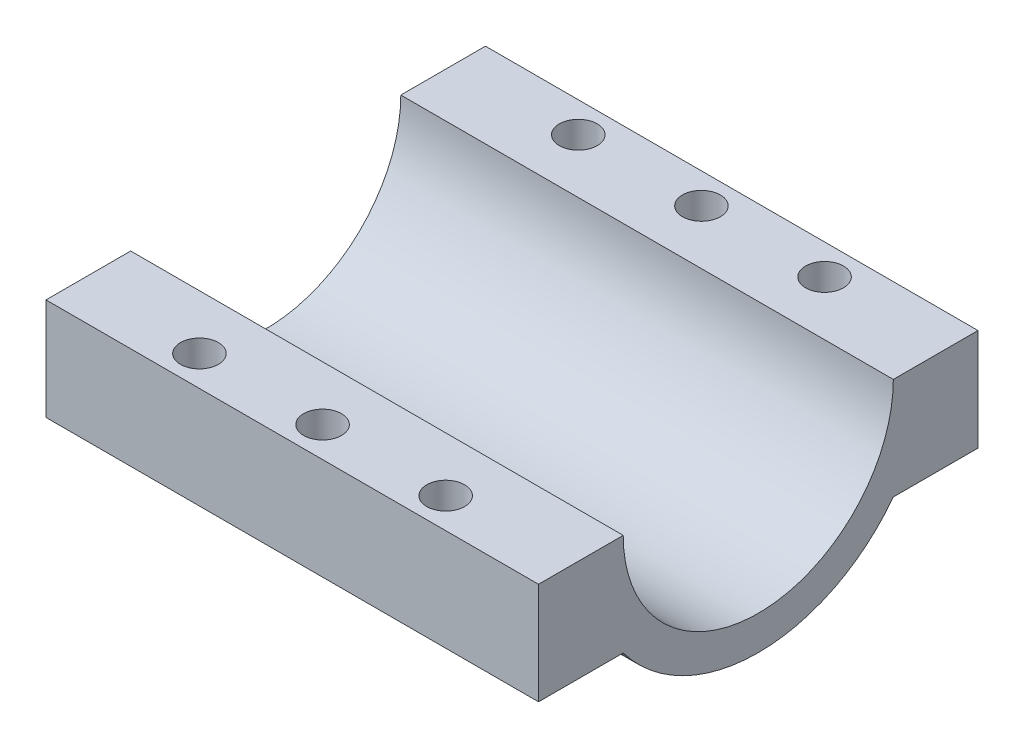
from build123d import *

# Parameters (mm, degrees)
SKETCH1_W           = 65
SKETCH1_H           = 58
SKETCH1_R           = 2.5
BOSS_EXTRUDE1_DEPTH = 22.325
SKETCH2_R           = 17.825
CUT_EXTRUDE1_DEPTH  = 75.594943696


with BuildPart() as part:
    # Sketch1 → Boss-Extrude1 (new body)
    with BuildSketch(Plane(origin=(0, 0, 0), x_dir=(1, 0, 0), z_dir=(0, 1, 0))):
        Rectangle(SKETCH1_W, SKETCH1_H)
        with Locations((-16.25, 25)):
            Circle(SKETCH1_R, mode=Mode.SUBTRACT)
        with Locations((16.25, 25)):
            Circle(SKETCH1_R, mode=Mode.SUBTRACT)
        with Locations((16.25, -25)):
            Circle(SKETCH1_R, mode=Mode.SUBTRACT)
        with Locations((-16.25, -25)):
            Circle(SKETCH1_R, mode=Mode.SUBTRACT)
        with Locations((0, 25)):
            Circle(SKETCH1_R, mode=Mode.SUBTRACT)
        with Locations((0, -25)):
            Circle(SKETCH1_R, mode=Mode.SUBTRACT)
    extrude(amount=BOSS_EXTRUDE1_DEPTH)

    # Sketch2 → Cut-Extrude1 (cut, through all)
    with BuildSketch(Plane(origin=(32.5, 0, 0), x_dir=(0, 0, -1), z_dir=(1, 0, 0))):
        with Locations((0, 22.325)):
            Circle(SKETCH2_R)
        with BuildLine():
            Line((-17.825, 8.88345991), (-29, 8.88345991))
            Line((-29, 8.88345991), (-29, -2.88343075))
            Line((-29, -2.88343075), (29, -2.88343075))
            Line((29, -2.88343075), (29, 8.88345991))
            Line((29, 8.88345991), (17.825, 8.88345991))
            ThreePointArc((17.825, 8.88345991), (0, 0), (-17.825, 8.88345991))
        make_face()
    extrude(amount=-CUT_EXTRUDE1_DEPTH, mode=Mode.SUBTRACT)


solid = part.part
